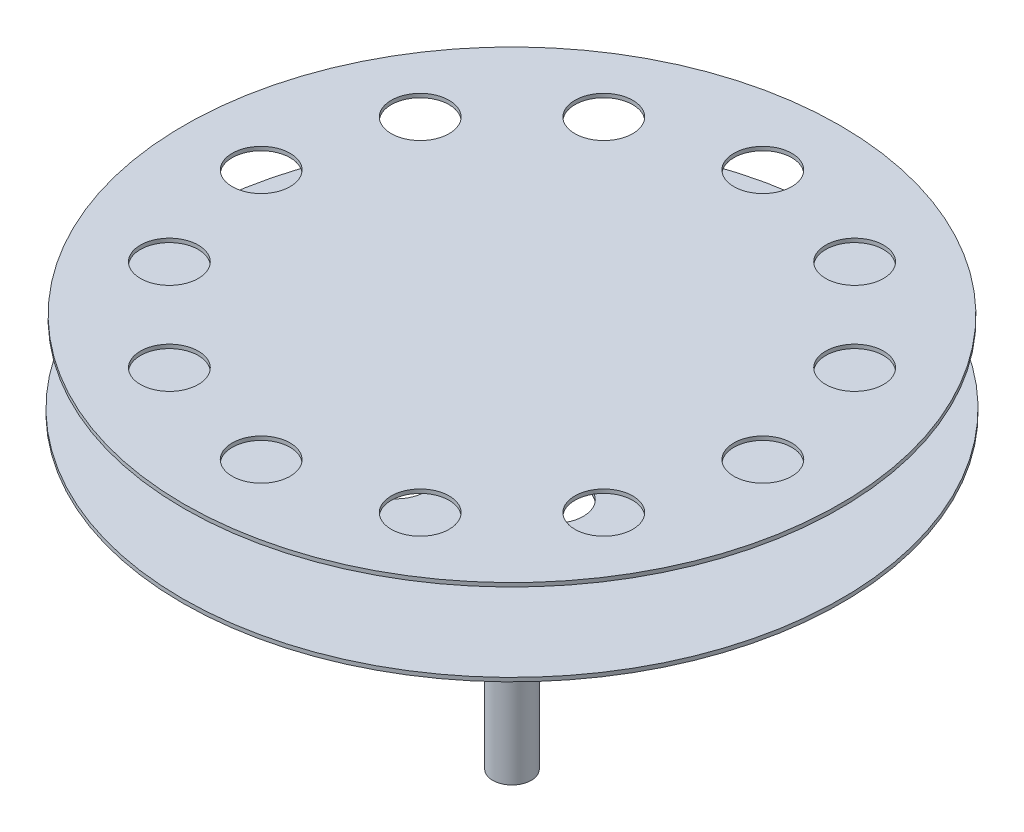
from build123d import *

# Parameters (mm, degrees)
SKETCH2_R          = 7.5
CUT_EXTRUDE1_DEPTH = 2
CIRPATTERN1_COUNT  = 12
SKETCH3_R          = 7.5
CUT_EXTRUDE2_DEPTH = 2
CIRPATTERN2_COUNT  = 6


with BuildPart() as part:
    # Sketch1 → Revolve1 (revolve)
    with BuildSketch(Plane.XY):
        Polygon((0, 102), (-84.99983, 102), (-84.99983, 101), (-5, 101), (-5, 81), (-85.40305253, 81), (-85.40305253, 80), (-5, 80), (-5, 0), (0, 0), align=None)
    revolve(axis=Axis((0, 54.874193188, 0), (0, -1, 0)))

    # Sketch2 → Cut-Extrude1 (cut)
    with BuildSketch(Plane(origin=(0, 102, 0), x_dir=(1, 0, 0), z_dir=(0, 1, 0))):
        with Locations((0, 65)):
            Circle(SKETCH2_R)
    cut_extrude1 = extrude(amount=-CUT_EXTRUDE1_DEPTH, mode=Mode.SUBTRACT)

    # CirPattern1: Cut-Extrude1 ×12 about axis
    cirpattern1_axis = Axis((0, 54.874193188, 0), (0, -1, 0))
    for i in range(1, CIRPATTERN1_COUNT):
        add(cut_extrude1.rotate(cirpattern1_axis, i * 360 / CIRPATTERN1_COUNT), mode=Mode.SUBTRACT)

    # Sketch3 → Cut-Extrude2 (cut)
    with BuildSketch(Plane.XZ.offset(-80)):
        with Locations((0, 30)):
            Circle(SKETCH3_R)
    cut_extrude2 = extrude(amount=-CUT_EXTRUDE2_DEPTH, mode=Mode.SUBTRACT)

    # CirPattern2: Cut-Extrude2 ×6 about axis
    cirpattern2_axis = Axis((0, 54.874193188, 0), (0, -1, 0))
    for i in range(1, CIRPATTERN2_COUNT):
        add(cut_extrude2.rotate(cirpattern2_axis, i * 360 / CIRPATTERN2_COUNT), mode=Mode.SUBTRACT)


solid = part.part
